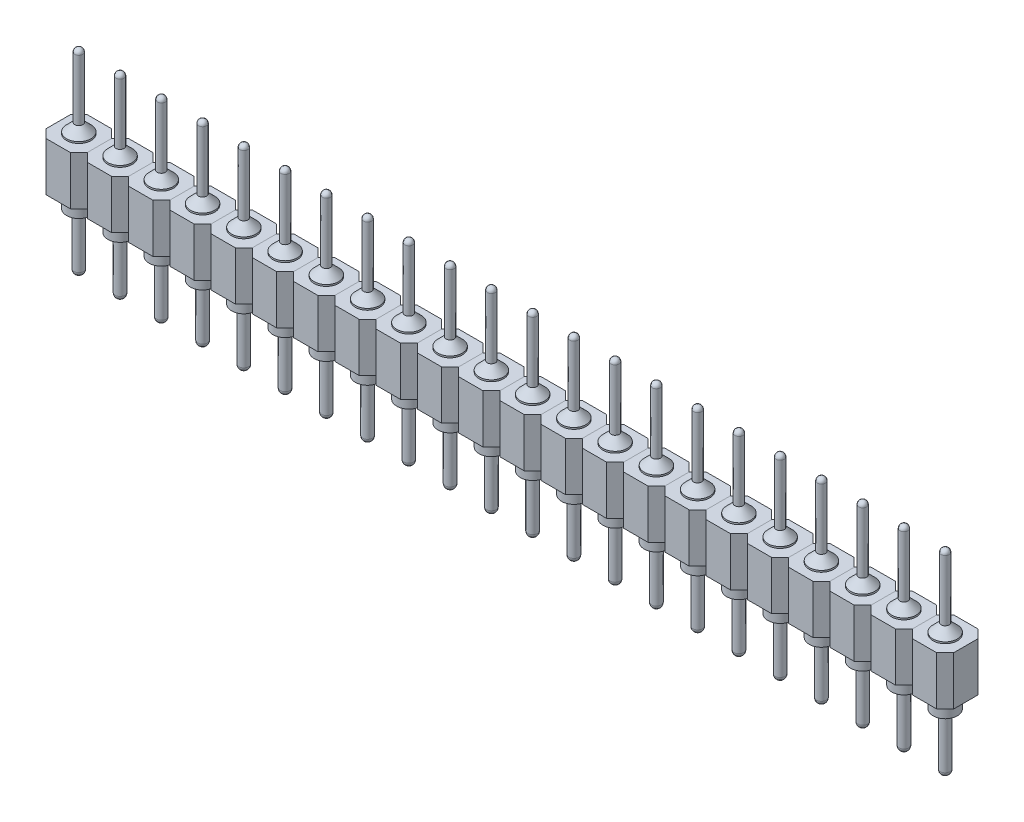
from build123d import *

# Parameters (mm, degrees)
EXTRUDE_START          = -1
SKETCH_3_R             = 0.75
EXTRUDE_1_DEPTH        = 3
PATTERN_LINEAR_1_COUNT = 22
PATTERN_LINEAR_1_PITCH = 2.54


with BuildPart() as part:
    # Эскиз2 → Повернуть1 (revolve)
    with BuildSketch(Plane.XY):
        with BuildLine():
            ThreePointArc((0, 0), (0.212132034, 0.087867966), (0.3, 0.3))
            Line((0.3, 0.3), (0.3, 3.5))
            Line((0.3, 3.5), (0.75, 3.5))
            Line((0.75, 3.5), (0.75, 7.6))
            Line((0.75, 7.6), (0.25, 8.1))
            Line((0.25, 8.1), (0.25, 11.85))
            ThreePointArc((0.25, 11.85), (0.176776695, 12.026776695), (0, 12.1))
            Line((0, 12.1), (0, 0))
        make_face()
    revolve(axis=Axis((0, 0, 0), (0, 1, 0)))


with BuildPart() as body_2:
    # Эскиз3 → Бобышка-Вытянуть1 (new body)
    with BuildSketch(Plane.XZ.offset(-3.5).offset(EXTRUDE_START)):
        Polygon((-0.75, 1.27), (0.75, 1.27), (1.27, 0.75), (1.27, -0.75), (0.75, -1.27), (-0.75, -1.27), (-1.27, -0.75), (-1.27, 0.75), align=None)
        Circle(SKETCH_3_R, mode=Mode.SUBTRACT)
    extrude(amount=-EXTRUDE_1_DEPTH)


with BuildPart() as pattern_linear_1_1:
    # Линейный массив1: pattern copy
    add(part.part.moved(Location(Vector(-1, 0, 0) * (1 * PATTERN_LINEAR_1_PITCH))))


with BuildPart() as pattern_linear_1_2:
    # Линейный массив1: pattern copy
    add(part.part.moved(Location(Vector(-1, 0, 0) * (2 * PATTERN_LINEAR_1_PITCH))))


with BuildPart() as pattern_linear_1_3:
    # Линейный массив1: pattern copy
    add(part.part.moved(Location(Vector(-1, 0, 0) * (3 * PATTERN_LINEAR_1_PITCH))))


with BuildPart() as pattern_linear_1_4:
    # Линейный массив1: pattern copy
    add(part.part.moved(Location(Vector(-1, 0, 0) * (4 * PATTERN_LINEAR_1_PITCH))))


with BuildPart() as pattern_linear_1_5:
    # Линейный массив1: pattern copy
    add(part.part.moved(Location(Vector(-1, 0, 0) * (5 * PATTERN_LINEAR_1_PITCH))))


with BuildPart() as pattern_linear_1_6:
    # Линейный массив1: pattern copy
    add(part.part.moved(Location(Vector(-1, 0, 0) * (6 * PATTERN_LINEAR_1_PITCH))))


with BuildPart() as pattern_linear_1_7:
    # Линейный массив1: pattern copy
    add(part.part.moved(Location(Vector(-1, 0, 0) * (7 * PATTERN_LINEAR_1_PITCH))))


with BuildPart() as pattern_linear_1_8:
    # Линейный массив1: pattern copy
    add(part.part.moved(Location(Vector(-1, 0, 0) * (8 * PATTERN_LINEAR_1_PITCH))))


with BuildPart() as pattern_linear_1_9:
    # Линейный массив1: pattern copy
    add(part.part.moved(Location(Vector(-1, 0, 0) * (9 * PATTERN_LINEAR_1_PITCH))))


with BuildPart() as pattern_linear_1_10:
    # Линейный массив1: pattern copy
    add(part.part.moved(Location(Vector(-1, 0, 0) * (10 * PATTERN_LINEAR_1_PITCH))))


with BuildPart() as pattern_linear_1_11:
    # Линейный массив1: pattern copy
    add(part.part.moved(Location(Vector(-1, 0, 0) * (11 * PATTERN_LINEAR_1_PITCH))))


with BuildPart() as pattern_linear_1_12:
    # Линейный массив1: pattern copy
    add(part.part.moved(Location(Vector(-1, 0, 0) * (12 * PATTERN_LINEAR_1_PITCH))))


with BuildPart() as pattern_linear_1_13:
    # Линейный массив1: pattern copy
    add(part.part.moved(Location(Vector(-1, 0, 0) * (13 * PATTERN_LINEAR_1_PITCH))))


with BuildPart() as pattern_linear_1_14:
    # Линейный массив1: pattern copy
    add(part.part.moved(Location(Vector(-1, 0, 0) * (14 * PATTERN_LINEAR_1_PITCH))))


with BuildPart() as pattern_linear_1_15:
    # Линейный массив1: pattern copy
    add(part.part.moved(Location(Vector(-1, 0, 0) * (15 * PATTERN_LINEAR_1_PITCH))))


with BuildPart() as pattern_linear_1_16:
    # Линейный массив1: pattern copy
    add(part.part.moved(Location(Vector(-1, 0, 0) * (16 * PATTERN_LINEAR_1_PITCH))))


with BuildPart() as pattern_linear_1_17:
    # Линейный массив1: pattern copy
    add(part.part.moved(Location(Vector(-1, 0, 0) * (17 * PATTERN_LINEAR_1_PITCH))))


with BuildPart() as pattern_linear_1_18:
    # Линейный массив1: pattern copy
    add(part.part.moved(Location(Vector(-1, 0, 0) * (18 * PATTERN_LINEAR_1_PITCH))))


with BuildPart() as pattern_linear_1_19:
    # Линейный массив1: pattern copy
    add(part.part.moved(Location(Vector(-1, 0, 0) * (19 * PATTERN_LINEAR_1_PITCH))))


with BuildPart() as pattern_linear_1_20:
    # Линейный массив1: pattern copy
    add(part.part.moved(Location(Vector(-1, 0, 0) * (20 * PATTERN_LINEAR_1_PITCH))))


with BuildPart() as pattern_linear_1_21:
    # Линейный массив1: pattern copy
    add(part.part.moved(Location(Vector(-1, 0, 0) * (21 * PATTERN_LINEAR_1_PITCH))))


with BuildPart() as pattern_linear_1_22:
    # Линейный массив1: pattern copy
    add(body_2.part.moved(Location(Vector(-1, 0, 0) * (1 * PATTERN_LINEAR_1_PITCH))))


with BuildPart() as pattern_linear_1_23:
    # Линейный массив1: pattern copy
    add(body_2.part.moved(Location(Vector(-1, 0, 0) * (2 * PATTERN_LINEAR_1_PITCH))))


with BuildPart() as pattern_linear_1_24:
    # Линейный массив1: pattern copy
    add(body_2.part.moved(Location(Vector(-1, 0, 0) * (3 * PATTERN_LINEAR_1_PITCH))))


with BuildPart() as pattern_linear_1_25:
    # Линейный массив1: pattern copy
    add(body_2.part.moved(Location(Vector(-1, 0, 0) * (4 * PATTERN_LINEAR_1_PITCH))))


with BuildPart() as pattern_linear_1_26:
    # Линейный массив1: pattern copy
    add(body_2.part.moved(Location(Vector(-1, 0, 0) * (5 * PATTERN_LINEAR_1_PITCH))))


with BuildPart() as pattern_linear_1_27:
    # Линейный массив1: pattern copy
    add(body_2.part.moved(Location(Vector(-1, 0, 0) * (6 * PATTERN_LINEAR_1_PITCH))))


with BuildPart() as pattern_linear_1_28:
    # Линейный массив1: pattern copy
    add(body_2.part.moved(Location(Vector(-1, 0, 0) * (7 * PATTERN_LINEAR_1_PITCH))))


with BuildPart() as pattern_linear_1_29:
    # Линейный массив1: pattern copy
    add(body_2.part.moved(Location(Vector(-1, 0, 0) * (8 * PATTERN_LINEAR_1_PITCH))))


with BuildPart() as pattern_linear_1_30:
    # Линейный массив1: pattern copy
    add(body_2.part.moved(Location(Vector(-1, 0, 0) * (9 * PATTERN_LINEAR_1_PITCH))))


with BuildPart() as pattern_linear_1_31:
    # Линейный массив1: pattern copy
    add(body_2.part.moved(Location(Vector(-1, 0, 0) * (10 * PATTERN_LINEAR_1_PITCH))))


with BuildPart() as pattern_linear_1_32:
    # Линейный массив1: pattern copy
    add(body_2.part.moved(Location(Vector(-1, 0, 0) * (11 * PATTERN_LINEAR_1_PITCH))))


with BuildPart() as pattern_linear_1_33:
    # Линейный массив1: pattern copy
    add(body_2.part.moved(Location(Vector(-1, 0, 0) * (12 * PATTERN_LINEAR_1_PITCH))))


with BuildPart() as pattern_linear_1_34:
    # Линейный массив1: pattern copy
    add(body_2.part.moved(Location(Vector(-1, 0, 0) * (13 * PATTERN_LINEAR_1_PITCH))))


with BuildPart() as pattern_linear_1_35:
    # Линейный массив1: pattern copy
    add(body_2.part.moved(Location(Vector(-1, 0, 0) * (14 * PATTERN_LINEAR_1_PITCH))))


with BuildPart() as pattern_linear_1_36:
    # Линейный массив1: pattern copy
    add(body_2.part.moved(Location(Vector(-1, 0, 0) * (15 * PATTERN_LINEAR_1_PITCH))))


with BuildPart() as pattern_linear_1_37:
    # Линейный массив1: pattern copy
    add(body_2.part.moved(Location(Vector(-1, 0, 0) * (16 * PATTERN_LINEAR_1_PITCH))))


with BuildPart() as pattern_linear_1_38:
    # Линейный массив1: pattern copy
    add(body_2.part.moved(Location(Vector(-1, 0, 0) * (17 * PATTERN_LINEAR_1_PITCH))))


with BuildPart() as pattern_linear_1_39:
    # Линейный массив1: pattern copy
    add(body_2.part.moved(Location(Vector(-1, 0, 0) * (18 * PATTERN_LINEAR_1_PITCH))))


with BuildPart() as pattern_linear_1_40:
    # Линейный массив1: pattern copy
    add(body_2.part.moved(Location(Vector(-1, 0, 0) * (19 * PATTERN_LINEAR_1_PITCH))))


with BuildPart() as pattern_linear_1_41:
    # Линейный массив1: pattern copy
    add(body_2.part.moved(Location(Vector(-1, 0, 0) * (20 * PATTERN_LINEAR_1_PITCH))))


with BuildPart() as pattern_linear_1_42:
    # Линейный массив1: pattern copy
    add(body_2.part.moved(Location(Vector(-1, 0, 0) * (21 * PATTERN_LINEAR_1_PITCH))))


solid = Compound([part.part, body_2.part, pattern_linear_1_1.part, pattern_linear_1_2.part, pattern_linear_1_3.part, pattern_linear_1_4.part, pattern_linear_1_5.part, pattern_linear_1_6.part, pattern_linear_1_7.part, pattern_linear_1_8.part, pattern_linear_1_9.part, pattern_linear_1_10.part, pattern_linear_1_11.part, pattern_linear_1_12.part, pattern_linear_1_13.part, pattern_linear_1_14.part, pattern_linear_1_15.part, pattern_linear_1_16.part, pattern_linear_1_17.part, pattern_linear_1_18.part, pattern_linear_1_19.part, pattern_linear_1_20.part, pattern_linear_1_21.part, pattern_linear_1_22.part, pattern_linear_1_23.part, pattern_linear_1_24.part, pattern_linear_1_25.part, pattern_linear_1_26.part, pattern_linear_1_27.part, pattern_linear_1_28.part, pattern_linear_1_29.part, pattern_linear_1_30.part, pattern_linear_1_31.part, pattern_linear_1_32.part, pattern_linear_1_33.part, pattern_linear_1_34.part, pattern_linear_1_35.part, pattern_linear_1_36.part, pattern_linear_1_37.part, pattern_linear_1_38.part, pattern_linear_1_39.part, pattern_linear_1_40.part, pattern_linear_1_41.part, pattern_linear_1_42.part])
